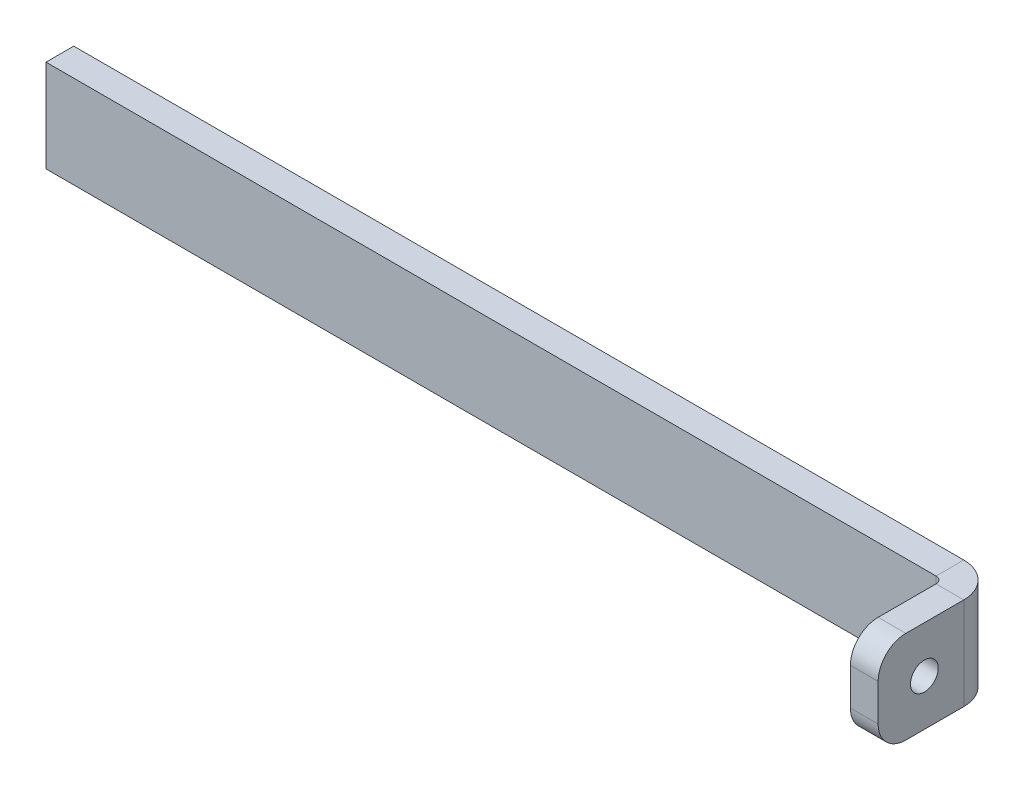
from build123d import *

# Parameters (mm, degrees)
SKETCH_1_W                       = 100
SKETCH_1_H                       = 10
SM_BASE_FLANGE_1_DEPTH           = 3
SM_EDGE_FLANGE_1_STRIP_W         = 13.4732
SM_EDGE_FLANGE_1_STRIP_H         = 3
SM_EDGE_FLANGE_1_STRIP_CUT_DEPTH = 10
SM_EDGE_FLANGE_1_DEPTH           = 10
SKETCH_9_R                       = 1.5
CUT_EXTRUDE_1_DEPTH              = 10
FILLET_1_R                       = 3


# Sheet-metal steps are written as plain solids
with BuildPart() as part:
    # Sketch 1 → 基体-法兰1 (new body)
    with BuildSketch(Plane.XY):
        Rectangle(SKETCH_1_W, SKETCH_1_H)
    extrude(amount=-SM_BASE_FLANGE_1_DEPTH)

    # 边线-法兰1 strip (across the edge) → 边线-法兰1 strip cut (cut)
    with BuildSketch(Plane(origin=(50, -5, 0), x_dir=(-1, 0, 0), z_dir=(0, 1, 0))):
        with Locations((-3, -1.5)):
            Rectangle(SM_EDGE_FLANGE_1_STRIP_W, SM_EDGE_FLANGE_1_STRIP_H)
    extrude(amount=SM_EDGE_FLANGE_1_STRIP_CUT_DEPTH, mode=Mode.SUBTRACT)

    # 边线-法兰1 section (across the edge) → 边线-法兰1 (add)
    with BuildSketch(Plane(origin=(50, -5, 0), x_dir=(-1, 0, 0), z_dir=(0, 1, 0))):
        with BuildLine():
            Line((0, 0.7366), (0, 10))
            Line((0, 10), (3, 10))
            Line((3, 10), (3, 0.7366))
            ThreePointArc((3, 0.7366), (3.215745145, 0.215745145), (3.7366, 0))
            Line((3.7366, 0), (3.7366, -3))
            ThreePointArc((3.7366, -3), (1.094424801, -1.905575199), (0, 0.7366))
        make_face()
    extrude(amount=SM_EDGE_FLANGE_1_DEPTH)

    # 草图9 → 切除-拉伸1 (cut)
    with BuildSketch(Plane(origin=(50, 0, 0), x_dir=(0, 0, -1), z_dir=(1, 0, 0))):
        with Locations((-5, 0)):
            Circle(SKETCH_9_R)
    extrude(amount=-CUT_EXTRUDE_1_DEPTH, mode=Mode.SUBTRACT)

    # 圆角1
    fillet_1_edges = [part.edges().sort_by_distance(p)[0] for p in [
        (48.5, -5, 10),
        (48.5, 5, 10),
    ]]
    fillet(fillet_1_edges, radius=FILLET_1_R)


solid = part.part
